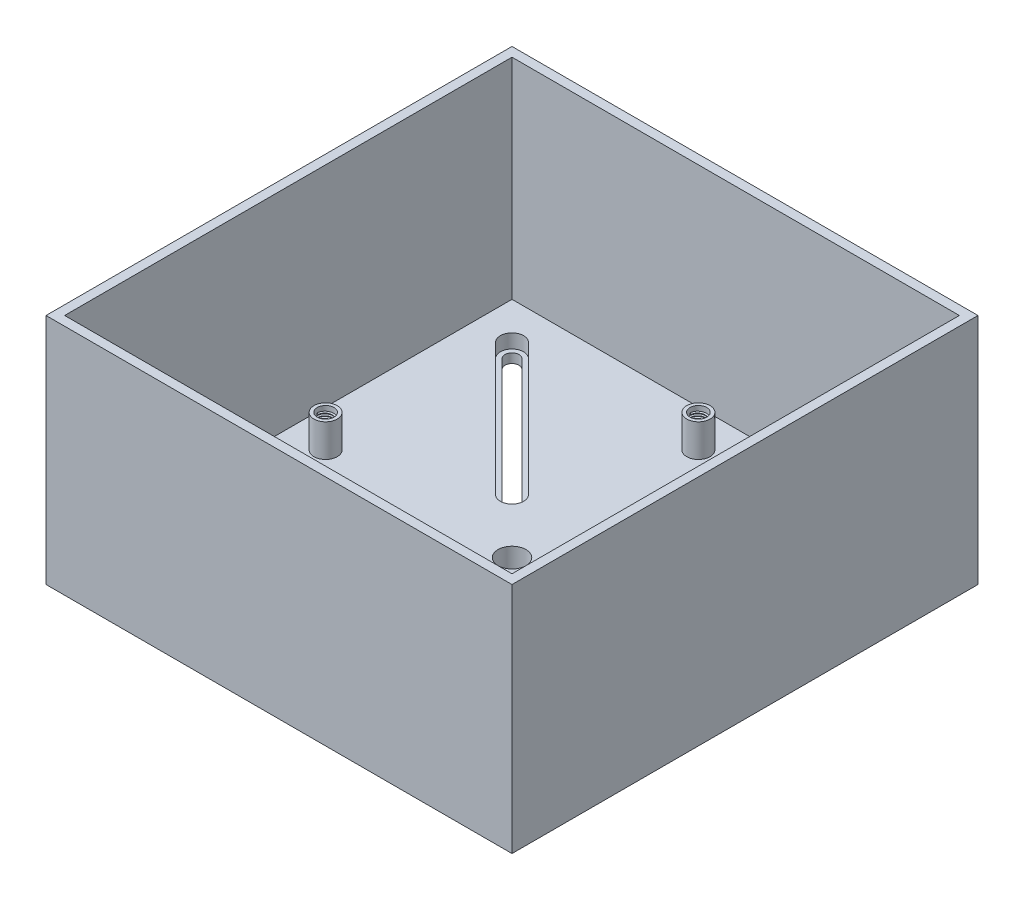
from build123d import *

# Parameters (mm, degrees)
IZIM1_W                           = 100
IZIM1_H                           = 100
IZIM1_W_2                         = 96
IZIM1_H_2                         = 96
EKSTR_ZYON_NCE4_DEPTH             = 50
IZIM1_3_W                         = 96
IZIM1_3_H                         = 96
IZIM1_3_R                         = 3
IZIM1_3_R_2                       = 2.5
Y_KSEKLIK_EKSTR_ZYON1_DEPTH       = 2
IZIM1_4_R                         = 2.5
Y_KSEKLIK_EKSTR_ZYON2_DEPTH       = 12
Y_KSEKLIK_EKSTR_ZYON3_START       = 2
Y_KSEKLIK_EKSTR_ZYON3_OUTLINE_W   = 96
Y_KSEKLIK_EKSTR_ZYON3_OUTLINE_H   = 96
Y_KSEKLIK_EKSTR_ZYON3_OUTLINE_R   = 3
Y_KSEKLIK_EKSTR_ZYON3_OUTLINE_R_2 = 2.5
Y_KSEKLIK_EKSTR_ZYON3_DEPTH       = 3
Y_KSEKLIK_EKSTR_ZYON4_START       = -2
IZIM2_R                           = 3
IZIM2_R_2                         = 2.5
Y_KSEKLIK_EKSTR_ZYON4_DEPTH       = 2
IZIM3_R                           = 1.8
KES_EKSTR_ZYON1_DEPTH             = 8
IZIM7_R                           = 1.8
KES_EKSTR_ZYON3_DEPTH             = 8
IZIM8_R                           = 1.8
KES_EKSTR_ZYON4_DEPTH             = 8
IZIM9_R                           = 1.8
KES_EKSTR_ZYON5_DEPTH             = 8
DI_1_PITCH                        = 0.5
DI_2_PITCH                        = 0.5
DI_3_PITCH                        = 0.5
DI_4_PITCH                        = 0.5
Y_KSEKLIK_EKSTR_ZYON5_DEPTH       = 5
Y_KSEKLIK_EKSTR_ZYON5_DEPTH_BACK  = 5
IZIM27_R                          = 2.5


with BuildPart() as part:
    # Çizim1 → Ekstrüzyon-İnce4 (new body)
    with BuildSketch(Plane(origin=(0, 0, 0), x_dir=(1, 0, 0), z_dir=(0, 1, 0))):
        Rectangle(IZIM1_W, IZIM1_H)
        Rectangle(IZIM1_W_2, IZIM1_H_2, mode=Mode.SUBTRACT)
    extrude(amount=EKSTR_ZYON_NCE4_DEPTH)

    # Çizim1<3> → Yükseklik-Ekstrüzyon1 (add)
    with BuildSketch(Plane(origin=(0, 0, 0), x_dir=(1, 0, 0), z_dir=(0, 1, 0))):
        Rectangle(IZIM1_3_W, IZIM1_3_H)
        with BuildLine():
            ThreePointArc((-41.060660172, 38.939339828), (-41.060660172, 41.060660172), (-38.939339828, 41.060660172))
            Line((-38.939339828, 41.060660172), (-10.655068581, 12.776388924))
            ThreePointArc((-10.655068581, 12.776388924), (-10.655068581, 10.655068581), (-12.776388924, 10.655068581))
            Line((-12.776388924, 10.655068581), (-41.060660172, 38.939339828))
        make_face(mode=Mode.SUBTRACT)
        with Locations(Location((-40, -40, 0), (0, 0, 270))):
            Circle(IZIM1_3_R, mode=Mode.SUBTRACT)
        with Locations(Location((-19.847456736, -19.847456736, 0), (0, 0, 270))):
            Circle(IZIM1_3_R_2, mode=Mode.SUBTRACT)
        with Locations(Location((0, 0, 0), (0, 0, 270))):
            Circle(IZIM1_3_R, mode=Mode.SUBTRACT)
        with BuildLine():
            ThreePointArc((41.060660172, -38.939339828), (41.060660172, -41.060660172), (38.939339828, -41.060660172))
            Line((38.939339828, -41.060660172), (10.655068581, -12.776388924))
            ThreePointArc((10.655068581, -12.776388924), (10.655068581, -10.655068581), (12.776388924, -10.655068581))
            Line((12.776388924, -10.655068581), (41.060660172, -38.939339828))
        make_face(mode=Mode.SUBTRACT)
        with Locations(Location((40, 40, 0), (0, 0, 270))):
            Circle(IZIM1_3_R, mode=Mode.SUBTRACT)
    extrude(amount=Y_KSEKLIK_EKSTR_ZYON1_DEPTH)

    # Çizim1<4> → Yükseklik-Ekstrüzyon2 (add)
    with BuildSketch(Plane(origin=(0, 0, 0), x_dir=(1, 0, 0), z_dir=(0, 1, 0))):
        with Locations(Location((-40, 0, 0), (0, 0, 270))):
            Circle(IZIM1_4_R)
        with Locations(Location((0, 40, 0), (0, 0, 270))):
            Circle(IZIM1_4_R)
        with Locations(Location((40, 0, 0), (0, 0, 270))):
            Circle(IZIM1_4_R)
        with Locations(Location((0, -40, 0), (0, 0, 270))):
            Circle(IZIM1_4_R)
    extrude(amount=Y_KSEKLIK_EKSTR_ZYON2_DEPTH)

    # Yükseklik-Ekstrüzyon3: read off the stored shape, not the designer's step
    # Yükseklik-Ekstrüzyon3 outline → Yükseklik-Ekstrüzyon3 (add)
    with BuildSketch(Plane(origin=(0, 0, 0), x_dir=(1, 0, 0), z_dir=(0, 1, 0)).offset(Y_KSEKLIK_EKSTR_ZYON3_START)):
        Rectangle(Y_KSEKLIK_EKSTR_ZYON3_OUTLINE_W, Y_KSEKLIK_EKSTR_ZYON3_OUTLINE_H)
        with Locations((-40, -40)):
            Circle(Y_KSEKLIK_EKSTR_ZYON3_OUTLINE_R, mode=Mode.SUBTRACT)
        with Locations((-19.847456736, -19.847456736)):
            Circle(Y_KSEKLIK_EKSTR_ZYON3_OUTLINE_R_2, mode=Mode.SUBTRACT)
        with Locations((0, -40)):
            Circle(Y_KSEKLIK_EKSTR_ZYON3_OUTLINE_R_2, mode=Mode.SUBTRACT)
        with BuildLine():
            Line((38.232233047, -41.767766953), (9.9479618, -13.483495706))
            ThreePointArc((9.9479618, -13.483495706), (9.9479618, -9.9479618), (13.483495706, -9.9479618))
            Line((13.483495706, -9.9479618), (41.767766953, -38.232233047))
            ThreePointArc((41.767766953, -38.232233047), (41.767766953, -41.767766953), (38.232233047, -41.767766953))
        make_face(mode=Mode.SUBTRACT)
        with Locations((-40, 0)):
            Circle(Y_KSEKLIK_EKSTR_ZYON3_OUTLINE_R_2, mode=Mode.SUBTRACT)
        with BuildLine():
            Line((-38.232233047, 41.767766953), (-9.9479618, 13.483495706))
            ThreePointArc((-9.9479618, 13.483495706), (-9.9479618, 9.9479618), (-13.483495706, 9.9479618))
            Line((-13.483495706, 9.9479618), (-41.767766953, 38.232233047))
            ThreePointArc((-41.767766953, 38.232233047), (-41.767766953, 41.767766953), (-38.232233047, 41.767766953))
        make_face(mode=Mode.SUBTRACT)
        Circle(Y_KSEKLIK_EKSTR_ZYON3_OUTLINE_R, mode=Mode.SUBTRACT)
        with Locations((40, 0)):
            Circle(Y_KSEKLIK_EKSTR_ZYON3_OUTLINE_R_2, mode=Mode.SUBTRACT)
        with Locations((0, 40)):
            Circle(Y_KSEKLIK_EKSTR_ZYON3_OUTLINE_R_2, mode=Mode.SUBTRACT)
        Polygon((40, 45), (44.330127019, 42.5), (44.330127019, 37.5), (40, 35), (35.669872981, 37.5), (35.669872981, 42.5), align=None, mode=Mode.SUBTRACT)
    extrude(amount=Y_KSEKLIK_EKSTR_ZYON3_DEPTH)

    # Çizim2 → Yükseklik-Ekstrüzyon4 (add)
    with BuildSketch(Plane(origin=(0, 5, 0), x_dir=(1, 0, 0), z_dir=(0, 1, 0)).offset(Y_KSEKLIK_EKSTR_ZYON4_START)):
        with Locations(Location((-40, -40, 0), (0, 0, 270))):
            Circle(IZIM2_R)
        with Locations(Location((-40, -40, 0), (0, 0, 270))):
            Circle(IZIM2_R_2, mode=Mode.SUBTRACT)
    extrude(amount=Y_KSEKLIK_EKSTR_ZYON4_DEPTH)

    # Çizim3 → Kes-Ekstrüzyon1 (cut)
    with BuildSketch(Plane(origin=(0, 12, 0), x_dir=(1, 0, 0), z_dir=(0, 1, 0))):
        with Locations(Location((40, 0, 0), (0, 0, 270))):
            Circle(IZIM3_R)
    extrude(amount=-KES_EKSTR_ZYON1_DEPTH, mode=Mode.SUBTRACT)

    # Çizim7 → Kes-Ekstrüzyon3 (cut)
    with BuildSketch(Plane(origin=(0, 12, 0), x_dir=(1, 0, 0), z_dir=(0, 1, 0))):
        with Locations(Location((0, -40, 0), (0, 0, 270))):
            Circle(IZIM7_R)
    extrude(amount=-KES_EKSTR_ZYON3_DEPTH, mode=Mode.SUBTRACT)

    # Çizim8 → Kes-Ekstrüzyon4 (cut)
    with BuildSketch(Plane(origin=(0, 12, 0), x_dir=(1, 0, 0), z_dir=(0, 1, 0))):
        with Locations(Location((-40, 0, 0), (0, 0, 270))):
            Circle(IZIM8_R)
    extrude(amount=-KES_EKSTR_ZYON4_DEPTH, mode=Mode.SUBTRACT)

    # Çizim9 → Kes-Ekstrüzyon5 (cut)
    with BuildSketch(Plane(origin=(0, 12, 0), x_dir=(1, 0, 0), z_dir=(0, 1, 0))):
        with Locations(Location((0, 40, 0), (0, 0, 270))):
            Circle(IZIM9_R)
    extrude(amount=-KES_EKSTR_ZYON5_DEPTH, mode=Mode.SUBTRACT)

    # Diş1: arcs per turn and ends read off the stored shape
    # Diş1: the profile of Diş Profili3 profile screwed along a right-hand helix through 14 turns, 6 arcs to a turn; built about Z, then put on its axis
    di_1_z = Axis((0, 0, 0), (0, 0, 1))
    di_1_corners = [(1.8003, 0, -0.000173205), (1.8003, 0, 0.437673204), (1.529367063, 0, 0.281249999), (1.529367063, 0, 0.156249999)]
    with BuildLine(mode=Mode.PRIVATE) as di_1_profile:
        Line(di_1_corners[0], di_1_corners[1])
        Line(di_1_corners[1], di_1_corners[2])
        Line(di_1_corners[2], di_1_corners[3])
        Line(di_1_corners[3], di_1_corners[0])
    di_1_cap = Face(di_1_profile.wire())
    di_1_turn_angles = [0, 30, 60, 90, 120, 150, 180, 210, 240, 270, 300, 330, 360]
    di_1_turn_weights = [1, 0.8660254037844387, 1, 0.8660254037844387, 1, 0.8660254037844387, 1, 0.8660254037844387, 1, 0.8660254037844387, 1, 0.8660254037844387, 1]
    di_1_turn_rails = [Edge.make_bspline([Vector(p[0], p[1], 0).rotate(di_1_z, di_1_turn_angles[k]) / di_1_turn_weights[k] + Vector(0, 0, p[2] + DI_1_PITCH * di_1_turn_angles[k] / 360) for k in range(13)], [0, 0, 0, 1, 1, 2, 2, 3, 3, 4, 4, 5, 5, 6, 6, 6], 2, di_1_turn_weights) for p in di_1_corners]
    di_1_turn_sides = [Face.make_surface_from_curves(di_1_turn_rails[p[0]], di_1_turn_rails[p[1]]) for p in [(0, 1), (1, 2), (2, 3), (3, 0)]]
    di_1 = Plane(origin=(0, 11, -40), x_dir=(-1, 0, 0), z_dir=(0, -1, 0)) * Solid(Shell([*[p.moved(Location((0, 0, DI_1_PITCH * i))) for i in range(14) for p in di_1_turn_sides], di_1_cap, di_1_cap.rotate(di_1_z, 5040).moved(Location((0, 0, DI_1_PITCH * 5040 / 360)))]))
    add(di_1)

    # Diş2: arcs per turn and ends read off the stored shape
    # Diş2: the profile of Diş Profili4 profile screwed along a right-hand helix through 14 turns, 6 arcs to a turn; built about Z, then put on its axis
    di_2_z = Axis((0, 0, 0), (0, 0, 1))
    di_2_corners = [(1.8003, 0, -0.000173205), (1.8003, 0, 0.437673204), (1.529367063, 0, 0.281249999), (1.529367063, 0, 0.156249999)]
    with BuildLine(mode=Mode.PRIVATE) as di_2_profile:
        Line(di_2_corners[0], di_2_corners[1])
        Line(di_2_corners[1], di_2_corners[2])
        Line(di_2_corners[2], di_2_corners[3])
        Line(di_2_corners[3], di_2_corners[0])
    di_2_cap = Face(di_2_profile.wire())
    di_2_turn_angles = [0, 30, 60, 90, 120, 150, 180, 210, 240, 270, 300, 330, 360]
    di_2_turn_weights = [1, 0.8660254037844387, 1, 0.8660254037844387, 1, 0.8660254037844387, 1, 0.8660254037844387, 1, 0.8660254037844387, 1, 0.8660254037844387, 1]
    di_2_turn_rails = [Edge.make_bspline([Vector(p[0], p[1], 0).rotate(di_2_z, di_2_turn_angles[k]) / di_2_turn_weights[k] + Vector(0, 0, p[2] + DI_2_PITCH * di_2_turn_angles[k] / 360) for k in range(13)], [0, 0, 0, 1, 1, 2, 2, 3, 3, 4, 4, 5, 5, 6, 6, 6], 2, di_2_turn_weights) for p in di_2_corners]
    di_2_turn_sides = [Face.make_surface_from_curves(di_2_turn_rails[p[0]], di_2_turn_rails[p[1]]) for p in [(0, 1), (1, 2), (2, 3), (3, 0)]]
    di_2 = Plane(origin=(-40, 11, 0), x_dir=(-1, 0, 0), z_dir=(0, -1, 0)) * Solid(Shell([*[p.moved(Location((0, 0, DI_2_PITCH * i))) for i in range(14) for p in di_2_turn_sides], di_2_cap, di_2_cap.rotate(di_2_z, 5040).moved(Location((0, 0, DI_2_PITCH * 5040 / 360)))]))
    add(di_2)

    # Diş3: arcs per turn and ends read off the stored shape
    # Diş3: the profile of Diş Profili5 profile screwed along a right-hand helix through 14 turns, 6 arcs to a turn; built about Z, then put on its axis
    di_3_z = Axis((0, 0, 0), (0, 0, 1))
    di_3_corners = [(1.8003, 0, -0.000173205), (1.8003, 0, 0.437673204), (1.529367063, 0, 0.281249999), (1.529367063, 0, 0.156249999)]
    with BuildLine(mode=Mode.PRIVATE) as di_3_profile:
        Line(di_3_corners[0], di_3_corners[1])
        Line(di_3_corners[1], di_3_corners[2])
        Line(di_3_corners[2], di_3_corners[3])
        Line(di_3_corners[3], di_3_corners[0])
    di_3_cap = Face(di_3_profile.wire())
    di_3_turn_angles = [0, 30, 60, 90, 120, 150, 180, 210, 240, 270, 300, 330, 360]
    di_3_turn_weights = [1, 0.8660254037844387, 1, 0.8660254037844387, 1, 0.8660254037844387, 1, 0.8660254037844387, 1, 0.8660254037844387, 1, 0.8660254037844387, 1]
    di_3_turn_rails = [Edge.make_bspline([Vector(p[0], p[1], 0).rotate(di_3_z, di_3_turn_angles[k]) / di_3_turn_weights[k] + Vector(0, 0, p[2] + DI_3_PITCH * di_3_turn_angles[k] / 360) for k in range(13)], [0, 0, 0, 1, 1, 2, 2, 3, 3, 4, 4, 5, 5, 6, 6, 6], 2, di_3_turn_weights) for p in di_3_corners]
    di_3_turn_sides = [Face.make_surface_from_curves(di_3_turn_rails[p[0]], di_3_turn_rails[p[1]]) for p in [(0, 1), (1, 2), (2, 3), (3, 0)]]
    di_3 = Plane(origin=(0, 11, 40), x_dir=(-1, 0, 0), z_dir=(0, -1, 0)) * Solid(Shell([*[p.moved(Location((0, 0, DI_3_PITCH * i))) for i in range(14) for p in di_3_turn_sides], di_3_cap, di_3_cap.rotate(di_3_z, 5040).moved(Location((0, 0, DI_3_PITCH * 5040 / 360)))]))
    add(di_3)

    # Diş4: arcs per turn and ends read off the stored shape
    # Diş4: the profile of Diş Profili6 profile screwed along a right-hand helix through 14 turns, 6 arcs to a turn; built about Z, then put on its axis
    di_4_z = Axis((0, 0, 0), (0, 0, 1))
    di_4_corners = [(1.8003, 0, -0.000173205), (1.8003, 0, 0.437673204), (1.529367063, 0, 0.281249999), (1.529367063, 0, 0.156249999)]
    with BuildLine(mode=Mode.PRIVATE) as di_4_profile:
        Line(di_4_corners[0], di_4_corners[1])
        Line(di_4_corners[1], di_4_corners[2])
        Line(di_4_corners[2], di_4_corners[3])
        Line(di_4_corners[3], di_4_corners[0])
    di_4_cap = Face(di_4_profile.wire())
    di_4_turn_angles = [0, 30, 60, 90, 120, 150, 180, 210, 240, 270, 300, 330, 360]
    di_4_turn_weights = [1, 0.8660254037844387, 1, 0.8660254037844387, 1, 0.8660254037844387, 1, 0.8660254037844387, 1, 0.8660254037844387, 1, 0.8660254037844387, 1]
    di_4_turn_rails = [Edge.make_bspline([Vector(p[0], p[1], 0).rotate(di_4_z, di_4_turn_angles[k]) / di_4_turn_weights[k] + Vector(0, 0, p[2] + DI_4_PITCH * di_4_turn_angles[k] / 360) for k in range(13)], [0, 0, 0, 1, 1, 2, 2, 3, 3, 4, 4, 5, 5, 6, 6, 6], 2, di_4_turn_weights) for p in di_4_corners]
    di_4_turn_sides = [Face.make_surface_from_curves(di_4_turn_rails[p[0]], di_4_turn_rails[p[1]]) for p in [(0, 1), (1, 2), (2, 3), (3, 0)]]
    di_4 = Plane(origin=(40, 11, 0), x_dir=(-1, 0, 0), z_dir=(0, -1, 0)) * Solid(Shell([*[p.moved(Location((0, 0, DI_4_PITCH * i))) for i in range(14) for p in di_4_turn_sides], di_4_cap, di_4_cap.rotate(di_4_z, 5040).moved(Location((0, 0, DI_4_PITCH * 5040 / 360)))]))
    add(di_4)

    # Çizim27 → Yükseklik-Ekstrüzyon5 (add, two sides: drawn at the far end of the back side and taken through both)
    with BuildSketch(Plane(origin=(0, 5, 0), x_dir=(1, 0, 0), z_dir=(0, 1, 0)).offset(-Y_KSEKLIK_EKSTR_ZYON5_DEPTH_BACK)):
        with Locations(Location((-19.847456736, -19.847456736, 0), (0, 0, 270))):
            Circle(IZIM27_R)
    extrude(amount=Y_KSEKLIK_EKSTR_ZYON5_DEPTH + Y_KSEKLIK_EKSTR_ZYON5_DEPTH_BACK)


solid = part.part
